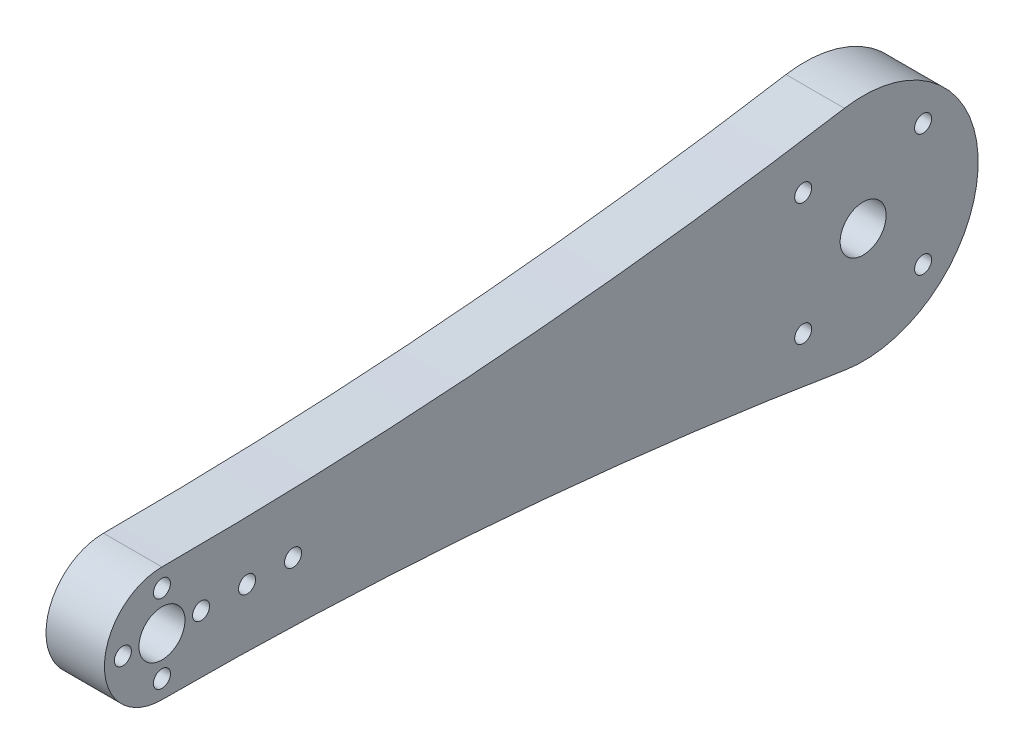
from build123d import *

# Parameters (mm, degrees)
BOSS_EXTRUDE1_DEPTH      = 12.7
CUT_EXTRUDE1_START       = -12.7
CUT_EXTRUDE1_OUTLINE_R   = 5
CUT_EXTRUDE1_OUTLINE_R_2 = 1.85
CUT_EXTRUDE1_DEPTH       = 12.7
SKETCH5_R                = 5
SKETCH5_R_2              = 1.85
CUT_EXTRUDE2_DEPTH       = 168.267151587


# Read off the part's stored shape, not the designer's step: Cut-Extrude1
with BuildPart() as part:
    # Sketch1 → Boss-Extrude1 (new body)
    with BuildSketch(Plane(origin=(0, 0, 0), x_dir=(0, 0, -1), z_dir=(1, 0, 0))):
        with BuildLine():
            ThreePointArc((-4.073644652, -24.665875603), (25, 0), (-4.073644652, 24.665875603))
            ThreePointArc((-4.073644652, 24.665875603), (-77.987776172, 15.546567094), (-152.4, 12.5))
            ThreePointArc((-152.4, 12.5), (-164.9, 0), (-152.4, -12.5))
            ThreePointArc((-152.4, -12.5), (-77.987776172, -15.546567094), (-4.073644652, -24.665875603))
        make_face()
    extrude(amount=BOSS_EXTRUDE1_DEPTH)

    # Cut-Extrude1 outline → Cut-Extrude1 (cut)
    with BuildSketch(Plane(origin=(12.7, 0, 0), x_dir=(0, 0, -1), z_dir=(1, 0, 0)).offset(CUT_EXTRUDE1_START)):
        Circle(CUT_EXTRUDE1_OUTLINE_R)
        with Locations((13.029498672, 13.274798425)):
            Circle(CUT_EXTRUDE1_OUTLINE_R_2)
        with Locations((13.029498672, -13.274798425)):
            Circle(CUT_EXTRUDE1_OUTLINE_R_2)
        with Locations((-13.029498672, -13.274798425)):
            Circle(CUT_EXTRUDE1_OUTLINE_R_2)
        with Locations((-13.029498672, 13.274798425)):
            Circle(CUT_EXTRUDE1_OUTLINE_R_2)
    extrude(amount=CUT_EXTRUDE1_DEPTH, mode=Mode.SUBTRACT)

    # Sketch5 → Cut-Extrude2 (cut, through all)
    with BuildSketch(Plane(origin=(12.7, 0, 0), x_dir=(0, 0, -1), z_dir=(1, 0, 0))):
        with Locations((-152.4, 0)):
            Circle(SKETCH5_R)
        with Locations((-143.9, 0)):
            Circle(SKETCH5_R_2)
        with Locations((-152.4, -8.5)):
            Circle(SKETCH5_R_2)
        with Locations((-160.9, 0)):
            Circle(SKETCH5_R_2)
        with Locations((-152.4, 8.5)):
            Circle(SKETCH5_R_2)
        with Locations((-133.9, 0)):
            Circle(SKETCH5_R_2)
        with Locations((-123.9, 0)):
            Circle(SKETCH5_R_2)
    extrude(amount=-CUT_EXTRUDE2_DEPTH, mode=Mode.SUBTRACT)


solid = part.part
